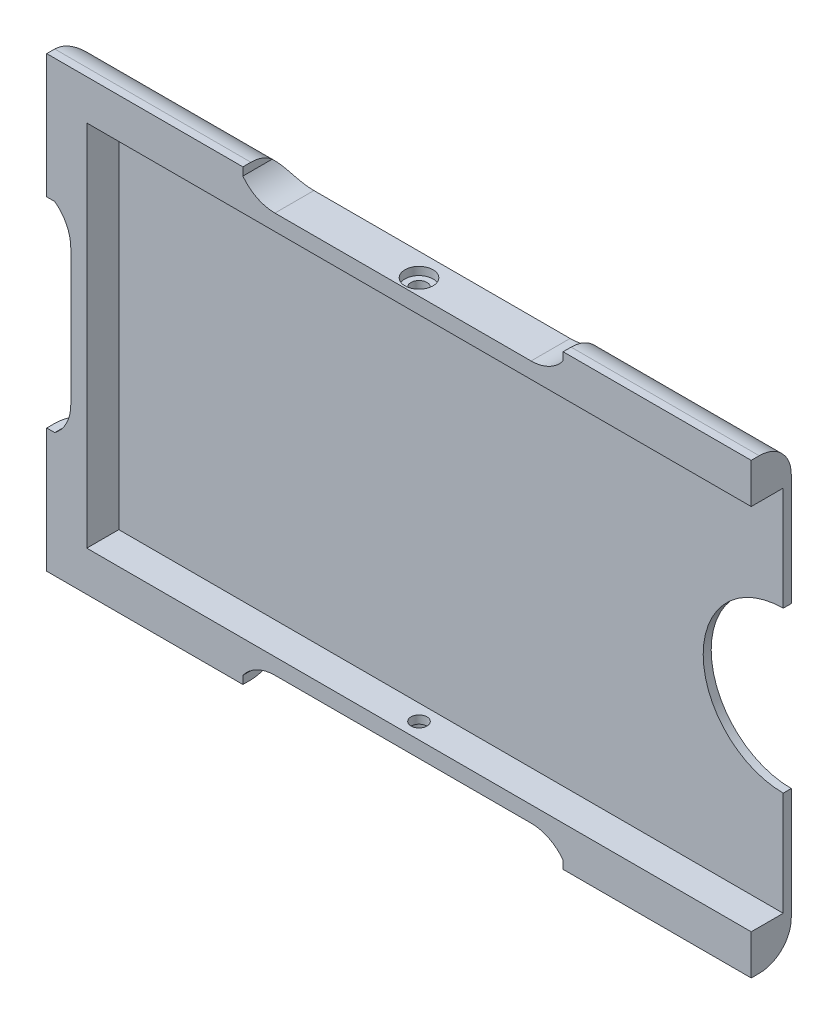
from build123d import *

# Parameters (mm, degrees)
Y_KSEKLIK_EKSTR_ZYON1_DEPTH = 5
IZIM6_W                     = 83
IZIM6_H                     = 46
KES_EKSTR_ZYON2_DEPTH       = 4
RADYUS1_R                   = 4
IZIM7_R                     = 1
KES_EKSTR_ZYON3_DEPTH       = 1000
IZIM9_R                     = 1.75
KES_EKSTR_ZYON5_DEPTH       = 1
KES_EKSTR_ZYON6_START       = -1
IZIM10_R                    = 1.75
KES_EKSTR_ZYON6_DEPTH       = 1


with BuildPart() as part:
    # Çizim4 → Yükseklik-Ekstrüzyon1 (new body)
    with BuildSketch(Plane.XY):
        with BuildLine():
            Line((202.815557626, -67.077395959), (202.815557626, -82.077395959))
            ThreePointArc((202.815557626, -82.077395959), (192.815557626, -92.077395959), (202.815557626, -102.077395959))
            Line((202.815557626, -102.077395959), (202.815557626, -117.077395959))
            Line((202.815557626, -117.077395959), (202.815557626, -120.077395959))
            Line((202.815557626, -120.077395959), (179.315557626, -120.077395959))
            Line((179.315557626, -120.077395959), (179.315557626, -119.077395959))
            ThreePointArc((179.315557626, -119.077395959), (177.551625603, -117.605260004), (175.315557626, -117.077395959))
            Line((175.315557626, -117.077395959), (143.315557626, -117.077395959))
            ThreePointArc((143.315557626, -117.077395959), (141.079489648, -117.605260004), (139.315557626, -119.077395959))
            Line((139.315557626, -119.077395959), (139.315557626, -120.077395959))
            Line((139.315557626, -120.077395959), (114.815557626, -120.077395959))
            Line((114.815557626, -120.077395959), (114.815557626, -104.577395959))
            Line((114.815557626, -104.577395959), (115.815557626, -104.577395959))
            ThreePointArc((115.815557626, -104.577395959), (117.287693581, -102.813463937), (117.815557626, -100.577395959))
            Line((117.815557626, -100.577395959), (117.815557626, -83.577395959))
            ThreePointArc((117.815557626, -83.577395959), (117.287693581, -81.341327982), (115.815557626, -79.577395959))
            Line((115.815557626, -79.577395959), (114.815557626, -79.577395959))
            Line((114.815557626, -79.577395959), (114.815557626, -64.077395959))
            Line((114.815557626, -64.077395959), (139.315557626, -64.077395959))
            Line((139.315557626, -64.077395959), (139.315557626, -65.077395959))
            ThreePointArc((139.315557626, -65.077395959), (141.079489648, -66.549531914), (143.315557626, -67.077395959))
            Line((143.315557626, -67.077395959), (175.315557626, -67.077395959))
            ThreePointArc((175.315557626, -67.077395959), (177.551625603, -66.549531914), (179.315557626, -65.077395959))
            Line((179.315557626, -65.077395959), (179.315557626, -64.077395959))
            Line((179.315557626, -64.077395959), (202.815557626, -64.077395959))
            Line((202.815557626, -64.077395959), (202.815557626, -67.077395959))
        make_face()
    extrude(amount=Y_KSEKLIK_EKSTR_ZYON1_DEPTH)

    # Çizim6 → Kes-Ekstrüzyon2 (cut)
    with BuildSketch(Plane.XY.offset(5)):
        with Locations((161.315557626, -92.077395959)):
            Rectangle(IZIM6_W, IZIM6_H)
    extrude(amount=-KES_EKSTR_ZYON2_DEPTH, mode=Mode.SUBTRACT)

    # Radyus1
    # the kernel refuses this fillet: 4 mm, written as the material it takes off along each edge
    with BuildSketch(Plane(origin=(155.315557626, -64.077395959, 0), x_dir=(0, -1, 0), z_dir=(1, 0, 0)), Plane(origin=(226.815557626, -120.077395959, 0), x_dir=(0, 1, 0), z_dir=(-1, 0, 0))) as radyus1_piece_1:
        with BuildLine():
            CenterArc((RADYUS1_R, -RADYUS1_R), RADYUS1_R, 90, 90)
            Line((0, -RADYUS1_R), (-RADYUS1_R * 0.02, -RADYUS1_R))
            Line((-RADYUS1_R * 0.02, -RADYUS1_R), (-RADYUS1_R * 0.02, RADYUS1_R * 0.02))
            Line((-RADYUS1_R * 0.02, RADYUS1_R * 0.02), (RADYUS1_R, RADYUS1_R * 0.02))
            Line((RADYUS1_R, RADYUS1_R * 0.02), (RADYUS1_R, 0))
        make_face()
    extrude(amount=71.5, mode=Mode.SUBTRACT)
    with BuildSketch(Plane(origin=(163.315557626, -120.077395959, 0), x_dir=(0, 1, 0), z_dir=(-1, 0, 0)), Plane(origin=(90.815557626, -64.077395959, 0), x_dir=(0, -1, 0), z_dir=(1, 0, 0))) as radyus1_piece_2:
        with BuildLine():
            CenterArc((RADYUS1_R, -RADYUS1_R), RADYUS1_R, 90, 90)
            Line((0, -RADYUS1_R), (-RADYUS1_R * 0.02, -RADYUS1_R))
            Line((-RADYUS1_R * 0.02, -RADYUS1_R), (-RADYUS1_R * 0.02, RADYUS1_R * 0.02))
            Line((-RADYUS1_R * 0.02, RADYUS1_R * 0.02), (RADYUS1_R, RADYUS1_R * 0.02))
            Line((RADYUS1_R, RADYUS1_R * 0.02), (RADYUS1_R, 0))
        make_face()
    extrude(amount=72.5, mode=Mode.SUBTRACT)
    with BuildSketch(Plane(origin=(114.815557626, -144.077395959, 0), x_dir=(1, 0, 0), z_dir=(0, 1, 0)), Plane(origin=(114.815557626, -103.577395959, 0), x_dir=(1, 0, 0), z_dir=(0, 1, 0))) as radyus1_piece_3:
        with BuildLine():
            CenterArc((RADYUS1_R, -RADYUS1_R), RADYUS1_R, 90, 90)
            Line((0, -RADYUS1_R), (-RADYUS1_R * 0.02, -RADYUS1_R))
            Line((-RADYUS1_R * 0.02, -RADYUS1_R), (-RADYUS1_R * 0.02, RADYUS1_R * 0.02))
            Line((-RADYUS1_R * 0.02, RADYUS1_R * 0.02), (RADYUS1_R, RADYUS1_R * 0.02))
            Line((RADYUS1_R, RADYUS1_R * 0.02), (RADYUS1_R, 0))
        make_face()
    extrude(amount=63.5, mode=Mode.SUBTRACT)

    # Çizim7 → Kes-Ekstrüzyon3 (cut)
    with BuildSketch(Plane(origin=(0, -67.077395959, 0), x_dir=(1, 0, 0), z_dir=(0, 1, 0))):
        with Locations(Location((159.315557626, -3, 0), (0, 0, 270))):
            Circle(IZIM7_R)
    extrude(amount=-KES_EKSTR_ZYON3_DEPTH, mode=Mode.SUBTRACT)

    # Çizim9 → Kes-Ekstrüzyon5 (cut)
    with BuildSketch(Plane(origin=(0, -117.077395959, 0), x_dir=(-1, 0, 0), z_dir=(0, -1, 0))):
        with Locations(Location((-159.315557626, -3, 0), (0, 0, 90))):
            Circle(IZIM9_R)
    extrude(amount=-KES_EKSTR_ZYON5_DEPTH, mode=Mode.SUBTRACT)

    # Çizim10 → Kes-Ekstrüzyon6 (cut)
    with BuildSketch(Plane(origin=(0, -67.077395959, 0), x_dir=(1, 0, 0), z_dir=(0, 1, 0)).offset(KES_EKSTR_ZYON6_START)):
        with Locations(Location((159.315557626, -3, 0), (0, 0, 90))):
            Circle(IZIM10_R)
    extrude(amount=KES_EKSTR_ZYON6_DEPTH, mode=Mode.SUBTRACT)


solid = part.part
